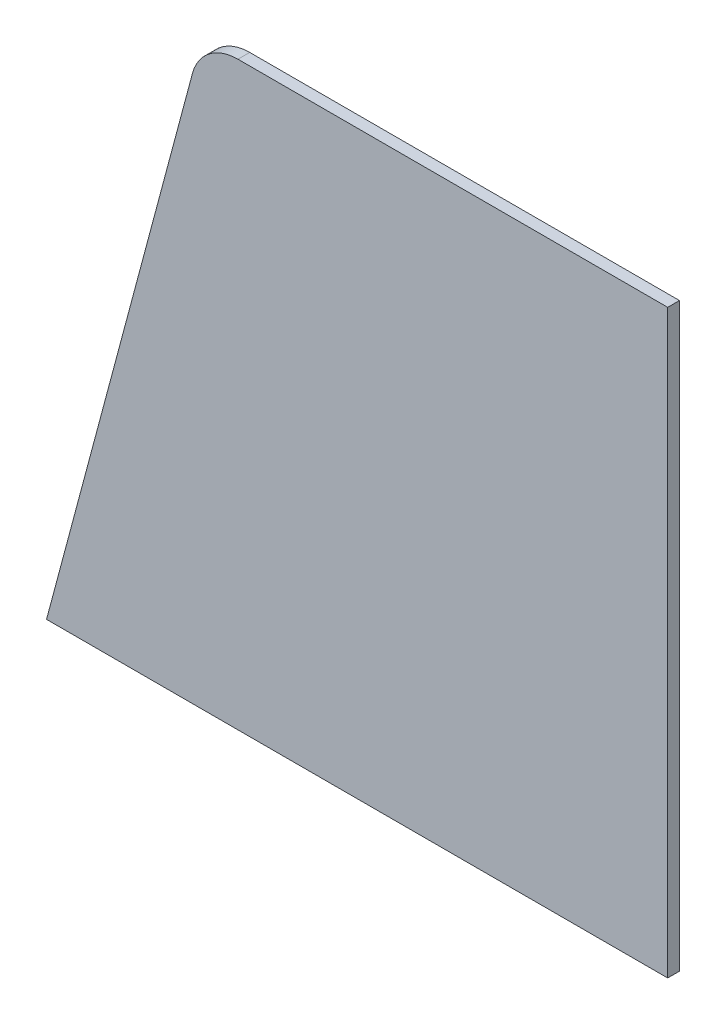
from build123d import *

# Parameters (mm, degrees)
BOSS_EXTRUDE1_DEPTH = 6.35


with BuildPart() as part:
    # Sketch1 → Boss-Extrude1 (new body)
    with BuildSketch(Plane.XY):
        with BuildLine():
            Line((0, 0), (335.28, 0))
            Line((335.28, 0), (335.28, 313.51728))
            Line((335.28, 313.51728), (103.321320582, 313.51728))
            ThreePointArc((103.321320582, 313.51728), (87.853181888, 308.264157806), (78.783155215, 294.677648925))
            Line((78.783155215, 294.677648925), (0, 0))
        make_face()
    extrude(amount=BOSS_EXTRUDE1_DEPTH)


solid = part.part
